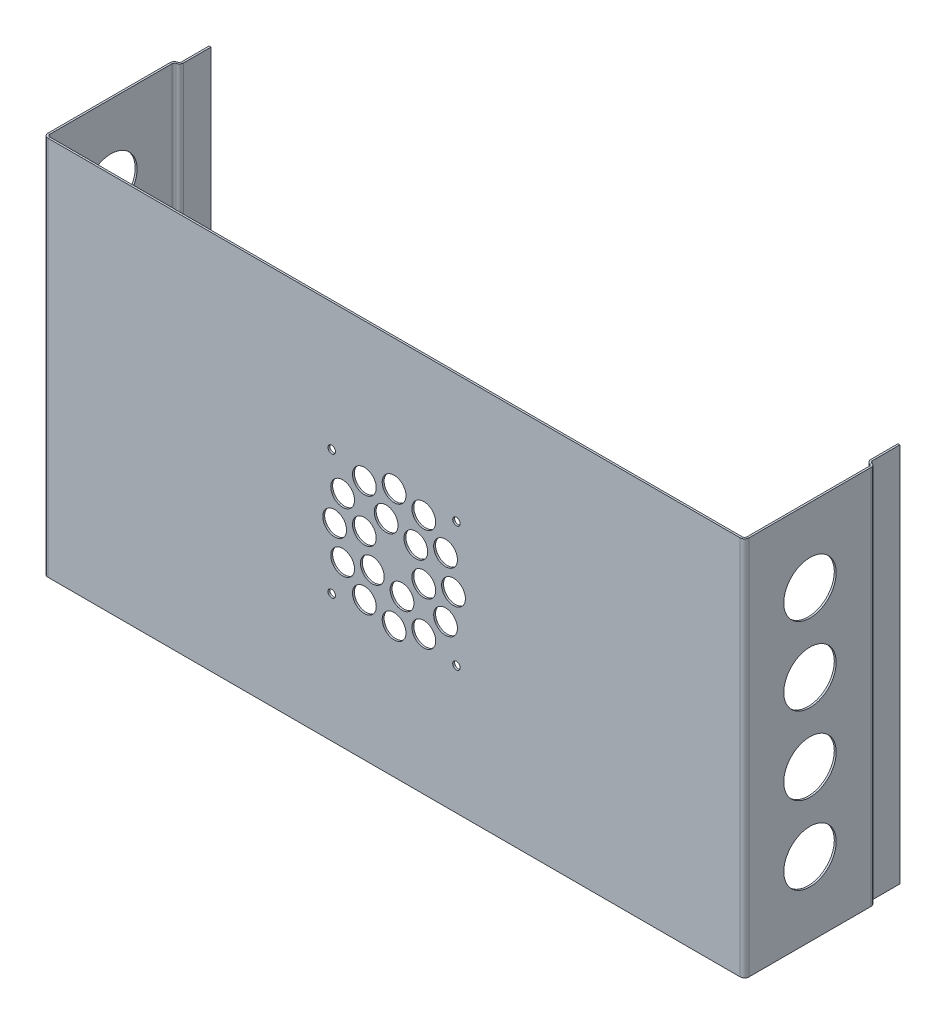
from build123d import *

# Parameters (mm, degrees)
BASE_FLANGE1_DEPTH = 152.4
JOG1_DEPTH         = 152.4
JOG1_2_DEPTH       = 152.4
JOG2_DEPTH         = 152.4
JOG2_2_DEPTH       = 152.4
SKETCH6_R          = 10.5
CUT_EXTRUDE1_DEPTH = 326.842676171
CUT_EXTRUDE4_REACH = 327.337
SKETCH8_R          = 4.7625
CIRPATTERN1_COUNT  = 12
CUT_EXTRUDE5_REACH = 327.337
SKETCH9_R          = 4.7625
CIRPATTERN2_COUNT  = 6
CUT_EXTRUDE6_REACH = 327.337
SKETCH10_R         = 1.5


# Read off the part's stored shape, not the designer's step: Jog1, Jog2
# Sheet-metal steps are written as plain solids
with BuildPart() as part:
    # Sketch1 → Base-Flange1 (new body)
    with BuildSketch(Plane(origin=(0, 0, 0), x_dir=(1, 0, 0), z_dir=(0, 1, 0))):
        with BuildLine():
            Line((0, 63.5), (0, 1))
            ThreePointArc((0, 1), (0.292893219, 0.292893219), (1, 0))
            Line((1, 0), (278.4, 0))
            ThreePointArc((278.4, 0), (279.107106781, 0.292893219), (279.4, 1))
            Line((279.4, 1), (279.4, 63.5))
            Line((279.4, 63.5), (280.15946, 63.5))
            Line((280.15946, 63.5), (280.15946, 1))
            ThreePointArc((280.15946, 1), (279.644126097, -0.244126097), (278.4, -0.75946))
            Line((278.4, -0.75946), (1, -0.75946))
            ThreePointArc((1, -0.75946), (-0.244126097, -0.244126097), (-0.75946, 1))
            Line((-0.75946, 1), (-0.75946, 63.5))
            Line((-0.75946, 63.5), (0, 63.5))
        make_face()
    extrude(amount=BASE_FLANGE1_DEPTH)

    # Jog1 outline → Jog1 (cut)
    with BuildSketch(Plane(origin=(0, 0, 0), x_dir=(1, 0, 0), z_dir=(0, 1, 0))):
        with BuildLine():
            Line((279.4, 63.5), (279.4, 51.344621925))
            ThreePointArc((279.4, 51.344621925), (279.958069237, 50.714354749), (280.15946, 49.896968827))
            Line((280.15946, 49.896968827), (280.15946, 63.5))
            Line((280.15946, 63.5), (279.4, 63.5))
        make_face()
    extrude(amount=JOG1_DEPTH, mode=Mode.SUBTRACT)

    # Jog1 2 outline → Jog1 2 (add)
    with BuildSketch(Plane(origin=(0, 0, 0), x_dir=(1, 0, 0), z_dir=(0, 1, 0))):
        with BuildLine():
            Line((278.114200802, 52.562402507), (278.114200802, 63.5))
            Line((278.114200802, 63.5), (277.354740802, 63.5))
            Line((277.354740802, 63.5), (277.354740802, 52.562402507))
            ThreePointArc((277.354740802, 52.562402507), (277.718327334, 51.491311123), (278.658819045, 50.862894653))
            ThreePointArc((278.658819045, 50.862894653), (279.19335334, 50.505730256), (279.4, 49.896968827))
            Line((279.4, 49.896968827), (279.4, 51.344621925))
            ThreePointArc((279.4, 51.344621925), (279.138506411, 51.493937133), (278.855381757, 51.596476681))
            ThreePointArc((278.855381757, 51.596476681), (278.320847462, 51.953641078), (278.114200802, 52.562402507))
        make_face()
    extrude(amount=JOG1_2_DEPTH)

    # Jog2 outline → Jog2 (cut)
    with BuildSketch(Plane(origin=(0, 0, 0), x_dir=(1, 0, 0), z_dir=(0, 1, 0))):
        with BuildLine():
            ThreePointArc((-0.75946, 49.896968827), (-0.558069237, 50.714354749), (0, 51.344621925))
            Line((0, 51.344621925), (0, 63.5))
            Line((0, 63.5), (-0.75946, 63.5))
            Line((-0.75946, 63.5), (-0.75946, 49.896968827))
        make_face()
    extrude(amount=JOG2_DEPTH, mode=Mode.SUBTRACT)

    # Jog2 2 outline → Jog2 2 (add)
    with BuildSketch(Plane(origin=(0, 0, 0), x_dir=(1, 0, 0), z_dir=(0, 1, 0))):
        with BuildLine():
            Line((2.045259198, 52.562402507), (2.045259198, 63.5))
            Line((2.045259198, 63.5), (1.285799198, 63.5))
            Line((1.285799198, 63.5), (1.285799198, 52.562402507))
            ThreePointArc((1.285799198, 52.562402507), (1.079152538, 51.953641078), (0.544618243, 51.596476681))
            ThreePointArc((0.544618243, 51.596476681), (0.261493589, 51.493937133), (0, 51.344621925))
            Line((0, 51.344621925), (0, 49.896968827))
            ThreePointArc((0, 49.896968827), (0.20664666, 50.505730256), (0.741180955, 50.862894653))
            ThreePointArc((0.741180955, 50.862894653), (1.681672666, 51.491311123), (2.045259198, 52.562402507))
        make_face()
    extrude(amount=JOG2_2_DEPTH)

    # Sketch6 → Cut-Extrude1 (cut, through all)
    with BuildSketch(Plane(origin=(280.15946, 0, 0), x_dir=(0, 0, -1), z_dir=(1, 0, 0))):
        with Locations((25.448484413, 122.85)):
            Circle(SKETCH6_R)
        with Locations((25.448484413, 91.75)):
            Circle(SKETCH6_R)
        with Locations((25.448484413, 60.65)):
            Circle(SKETCH6_R)
        with Locations((25.448484413, 29.55)):
            Circle(SKETCH6_R)
    extrude(amount=-CUT_EXTRUDE1_DEPTH, mode=Mode.SUBTRACT)

    # Sketch8 → Cut-Extrude4 (cut, up to next)
    with BuildSketch(Plane.XY.offset(0.75946), mode=Mode.PRIVATE) as cut_extrude4_sk1:
        with Locations((139.7, 100.0125)):
            Circle(SKETCH8_R)
    cut_extrude4_tool1 = extrude(cut_extrude4_sk1.sketch, amount=-CUT_EXTRUDE4_REACH, mode=Mode.PRIVATE) & part.part
    cut_extrude4 = cut_extrude4_tool1.solids().sort_by_distance((139.7, 100.0125, 0.75946))[0]
    add(cut_extrude4, mode=Mode.SUBTRACT)

    # CirPattern1: Cut-Extrude4 ×12 about axis
    cirpattern1_axis = Axis((139.7, 76.2, 0), (0, 0, 1))
    for i in range(1, CIRPATTERN1_COUNT):
        add(cut_extrude4.rotate(cirpattern1_axis, i * 360 / CIRPATTERN1_COUNT), mode=Mode.SUBTRACT)

    # Sketch9 → Cut-Extrude5 (cut, up to next)
    with BuildSketch(Plane.XY.offset(0.75946), mode=Mode.PRIVATE) as cut_extrude5_sk1:
        with Locations((136.509729928, 88.10625)):
            Circle(SKETCH9_R)
    cut_extrude5_tool1 = extrude(cut_extrude5_sk1.sketch, amount=-CUT_EXTRUDE5_REACH, mode=Mode.PRIVATE) & part.part
    cut_extrude5 = cut_extrude5_tool1.solids().sort_by_distance((136.50973, 88.10625, 0.75946))[0]
    add(cut_extrude5, mode=Mode.SUBTRACT)

    # CirPattern2: Cut-Extrude5 ×6 about axis
    cirpattern2_axis = Axis((139.7, 76.2, 0), (0, 0, 1))
    for i in range(1, CIRPATTERN2_COUNT):
        add(cut_extrude5.rotate(cirpattern2_axis, i * 360 / CIRPATTERN2_COUNT), mode=Mode.SUBTRACT)

    # Sketch10 → Cut-Extrude6 (cut, up to next)
    with BuildSketch(Plane.XY.offset(0.75946), mode=Mode.PRIVATE) as cut_extrude6_sk1:
        with Locations((114.7, 51.2)):
            Circle(SKETCH10_R)
    cut_extrude6_tool1 = extrude(cut_extrude6_sk1.sketch, amount=-CUT_EXTRUDE6_REACH, mode=Mode.PRIVATE) & part.part
    # Sketch10 → Cut-Extrude6 (cut, up to next)
    with BuildSketch(Plane.XY.offset(0.75946), mode=Mode.PRIVATE) as cut_extrude6_sk2:
        with Locations((114.7, 101.2)):
            Circle(SKETCH10_R)
    cut_extrude6_tool2 = extrude(cut_extrude6_sk2.sketch, amount=-CUT_EXTRUDE6_REACH, mode=Mode.PRIVATE) & part.part
    # Sketch10 → Cut-Extrude6 (cut, up to next)
    with BuildSketch(Plane.XY.offset(0.75946), mode=Mode.PRIVATE) as cut_extrude6_sk3:
        with Locations((164.7, 101.2)):
            Circle(SKETCH10_R)
    cut_extrude6_tool3 = extrude(cut_extrude6_sk3.sketch, amount=-CUT_EXTRUDE6_REACH, mode=Mode.PRIVATE) & part.part
    # Sketch10 → Cut-Extrude6 (cut, up to next)
    with BuildSketch(Plane.XY.offset(0.75946), mode=Mode.PRIVATE) as cut_extrude6_sk4:
        with Locations((164.7, 51.2)):
            Circle(SKETCH10_R)
    cut_extrude6_tool4 = extrude(cut_extrude6_sk4.sketch, amount=-CUT_EXTRUDE6_REACH, mode=Mode.PRIVATE) & part.part
    add(cut_extrude6_tool1.solids().sort_by_distance((114.7, 51.2, 0.75946))[0], mode=Mode.SUBTRACT)
    add(cut_extrude6_tool2.solids().sort_by_distance((114.7, 101.2, 0.75946))[0], mode=Mode.SUBTRACT)
    add(cut_extrude6_tool3.solids().sort_by_distance((164.7, 101.2, 0.75946))[0], mode=Mode.SUBTRACT)
    add(cut_extrude6_tool4.solids().sort_by_distance((164.7, 51.2, 0.75946))[0], mode=Mode.SUBTRACT)


solid = part.part
